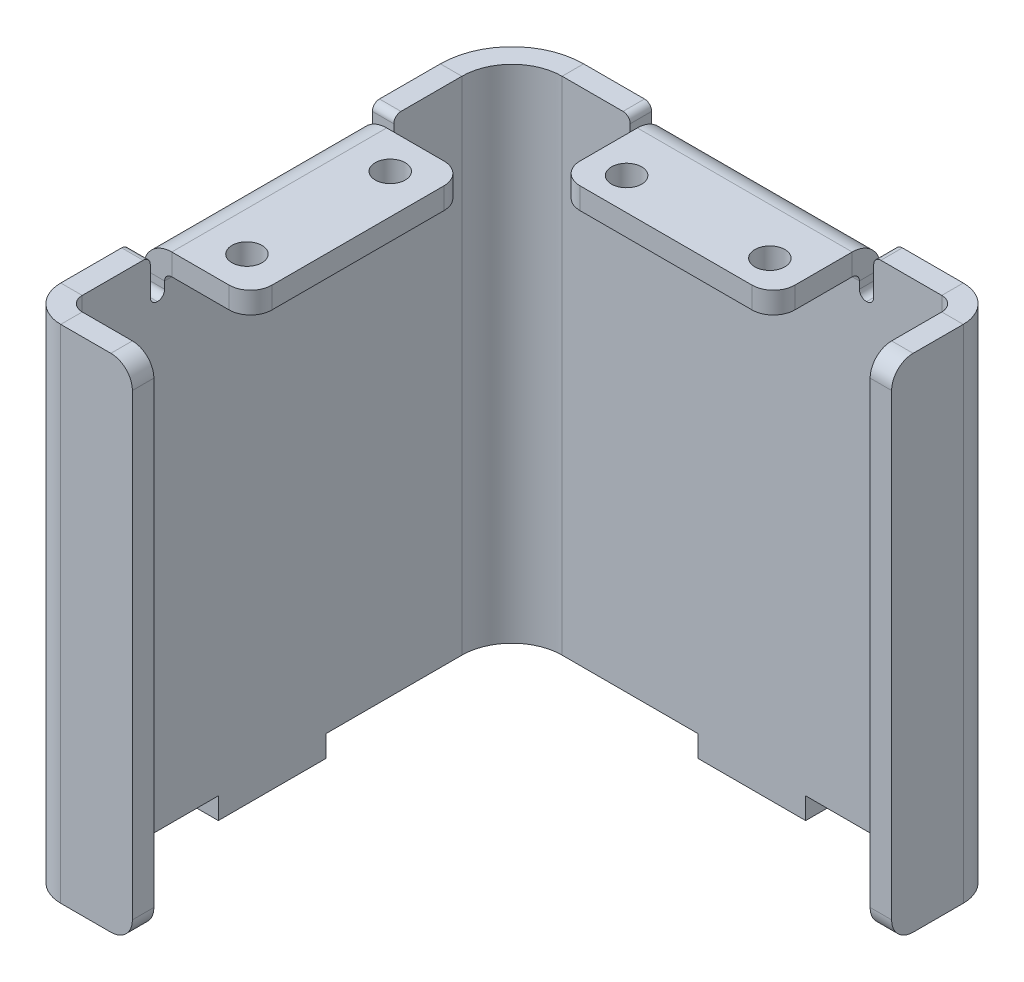
from build123d import *

# Parameters (mm, degrees)
BASE_FLANGE1_DEPTH           = 70
EDGE_FLANGE1_STRIP_W         = 16
EDGE_FLANGE1_STRIP_H         = 3
EDGE_FLANGE1_STRIP_CUT_DEPTH = 70
EDGE_FLANGE1_DEPTH           = 70
EDGE_FLANGE2_STRIP_W         = 16
EDGE_FLANGE2_STRIP_H         = 3
EDGE_FLANGE2_STRIP_CUT_DEPTH = 70
EDGE_FLANGE2_DEPTH           = 70
SKETCH19_W                   = 15
SKETCH19_H                   = 6
BOSS_EXTRUDE1_DEPTH          = 3
SKETCH20_W                   = 15
SKETCH20_H                   = 6
BOSS_EXTRUDE2_DEPTH          = 3
CUT_EXTRUDE6_DEPTH           = 3
EDGE_FLANGE8_STRIP_W         = 14
EDGE_FLANGE8_STRIP_H         = 3
EDGE_FLANGE8_STRIP_CUT_DEPTH = 30
EDGE_FLANGE8_DEPTH           = 30
SKETCH71_R                   = 2.1
CUT_EXTRUDE7_DEPTH           = 3
CUT_EXTRUDE8_DEPTH           = 3
EDGE_FLANGE9_STRIP_W         = 14
EDGE_FLANGE9_STRIP_H         = 3
EDGE_FLANGE9_STRIP_CUT_DEPTH = 30
EDGE_FLANGE9_DEPTH           = 30
SKETCH77_R                   = 2.1
CUT_EXTRUDE9_DEPTH           = 3
FILLET1_R                    = 1
FILLET2_R                    = 3


# Sheet-metal steps are written as plain solids
with BuildPart() as part:
    # Sketch1 → Base-Flange1 (new body)
    with BuildSketch(Plane(origin=(0, 0, 0), x_dir=(1, 0, 0), z_dir=(0, 1, 0))):
        with BuildLine():
            Line((0, 0), (-58, 0))
            ThreePointArc((-58, 0), (-65.071067812, -2.928932188), (-68, -10))
            Line((-68, -10), (-68, -68))
            Line((-68, -68), (-65, -68))
            Line((-65, -68), (-65, -10))
            ThreePointArc((-65, -10), (-62.949747468, -5.050252532), (-58, -3))
            Line((-58, -3), (0, -3))
            Line((0, -3), (0, 0))
        make_face()
    extrude(amount=BASE_FLANGE1_DEPTH)

    # Edge-Flange1 strip (across the edge) → Edge-Flange1 strip cut (cut)
    with BuildSketch(Plane(origin=(0, 0, 3), x_dir=(-1, 0, 0), z_dir=(0, 1, 0))):
        with Locations((-3, -1.5)):
            Rectangle(EDGE_FLANGE1_STRIP_W, EDGE_FLANGE1_STRIP_H)
    extrude(amount=EDGE_FLANGE1_STRIP_CUT_DEPTH, mode=Mode.SUBTRACT)

    # Edge-Flange1 section (across the edge) → Edge-Flange1 (add)
    with BuildSketch(Plane(origin=(0, 0, 3), x_dir=(-1, 0, 0), z_dir=(0, 1, 0))):
        with BuildLine():
            Line((0, 2), (0, 12))
            Line((0, 12), (3, 12))
            Line((3, 12), (3, 2))
            ThreePointArc((3, 2), (3.585786438, 0.585786438), (5, 0))
            Line((5, 0), (5, -3))
            ThreePointArc((5, -3), (1.464466094, -1.535533906), (0, 2))
        make_face()
    extrude(amount=EDGE_FLANGE1_DEPTH)

    # Edge-Flange2 strip (across the edge) → Edge-Flange2 strip cut (cut)
    with BuildSketch(Plane(origin=(-65, 70, 68), x_dir=(0, 0, -1), z_dir=(0, -1, 0))):
        with Locations((-3, -1.5)):
            Rectangle(EDGE_FLANGE2_STRIP_W, EDGE_FLANGE2_STRIP_H)
    extrude(amount=EDGE_FLANGE2_STRIP_CUT_DEPTH, mode=Mode.SUBTRACT)

    # Edge-Flange2 section (across the edge) → Edge-Flange2 (add)
    with BuildSketch(Plane(origin=(-65, 70, 68), x_dir=(0, 0, -1), z_dir=(0, -1, 0))):
        with BuildLine():
            Line((0, 2), (0, 12))
            Line((0, 12), (3, 12))
            Line((3, 12), (3, 2))
            ThreePointArc((3, 2), (3.585786438, 0.585786438), (5, 0))
            Line((5, 0), (5, -3))
            ThreePointArc((5, -3), (1.464466094, -1.535533906), (0, 2))
        make_face()
    extrude(amount=EDGE_FLANGE2_DEPTH)

    # Sketch19 → Boss-Extrude1 (add)
    with BuildSketch(Plane.XY.offset(3)):
        with Locations((-31.5, 0)):
            Rectangle(SKETCH19_W, SKETCH19_H)
    extrude(amount=-BOSS_EXTRUDE1_DEPTH)

    # Sketch20 → Boss-Extrude2 (add)
    with BuildSketch(Plane(origin=(-65, 0, 0), x_dir=(0, 0, -1), z_dir=(1, 0, 0))):
        with Locations((-36.5, 0)):
            Rectangle(SKETCH20_W, SKETCH20_H)
    extrude(amount=-BOSS_EXTRUDE2_DEPTH)

    # Sketch63 → Cut-Extrude6 (cut)
    with BuildSketch(Plane(origin=(-65, 0, 0), x_dir=(0, 0, -1), z_dir=(1, 0, 0))):
        Polygon((-51.5, 64), (-51.5, 67), (-51.5, 70), (-53.5, 70), (-53.5, 64), align=None)
        Polygon((-21.5, 70), (-21.5, 67), (-21.5, 64), (-19.5, 64), (-19.5, 70), align=None)
    extrude(amount=-CUT_EXTRUDE6_DEPTH, mode=Mode.SUBTRACT)

    # Edge-Flange8 strip (across the edge) → Edge-Flange8 strip cut (cut)
    with BuildSketch(Plane(origin=(-65, 70, 21.5), x_dir=(0, -1, 0), z_dir=(0, 0, 1))):
        with Locations((-3, -1.5)):
            Rectangle(EDGE_FLANGE8_STRIP_W, EDGE_FLANGE8_STRIP_H)
    extrude(amount=EDGE_FLANGE8_STRIP_CUT_DEPTH, mode=Mode.SUBTRACT)

    # Edge-Flange8 section (across the edge) → Edge-Flange8 (add)
    with BuildSketch(Plane(origin=(-65, 70, 21.5), x_dir=(0, -1, 0), z_dir=(0, 0, 1))):
        with BuildLine():
            Line((0, 1), (0, 12))
            Line((0, 12), (3, 12))
            Line((3, 12), (3, 1))
            ThreePointArc((3, 1), (3.292893219, 0.292893219), (4, 0))
            Line((4, 0), (4, -3))
            ThreePointArc((4, -3), (1.171572875, -1.828427125), (0, 1))
        make_face()
    extrude(amount=EDGE_FLANGE8_DEPTH)

    # Sketch71 → Cut-Extrude7 (cut)
    with BuildSketch(Plane(origin=(0, 70, 0), x_dir=(1, 0, 0), z_dir=(0, 1, 0))):
        with Locations(Location((-58.5, -26.5, 0), (0, 0, 180))):
            Circle(SKETCH71_R)
        with Locations(Location((-58.5, -46.5, 0), (0, 0, 180))):
            Circle(SKETCH71_R)
    extrude(amount=-CUT_EXTRUDE7_DEPTH, mode=Mode.SUBTRACT)

    # Sketch72 → Cut-Extrude8 (cut)
    with BuildSketch(Plane.XY.offset(3)):
        Polygon((-46.5, 66.882619945), (-46.5, 70), (-48.5, 70), (-48.5, 64), (-46.5, 64), align=None)
        Polygon((-14.5, 70), (-16.5, 70), (-16.5, 66.882619945), (-16.5, 64), (-14.5, 64), align=None)
    extrude(amount=-CUT_EXTRUDE8_DEPTH, mode=Mode.SUBTRACT)

    # Edge-Flange9 strip (across the edge) → Edge-Flange9 strip cut (cut)
    with BuildSketch(Plane(origin=(-16.5, 70, 3), x_dir=(0, -1, 0), z_dir=(-1, 0, 0))):
        with Locations((-3, -1.5)):
            Rectangle(EDGE_FLANGE9_STRIP_W, EDGE_FLANGE9_STRIP_H)
    extrude(amount=EDGE_FLANGE9_STRIP_CUT_DEPTH, mode=Mode.SUBTRACT)

    # Edge-Flange9 section (across the edge) → Edge-Flange9 (add)
    with BuildSketch(Plane(origin=(-16.5, 70, 3), x_dir=(0, -1, 0), z_dir=(-1, 0, 0))):
        with BuildLine():
            Line((0, 1), (0, 12))
            Line((0, 12), (3, 12))
            Line((3, 12), (3, 1))
            ThreePointArc((3, 1), (3.292893219, 0.292893219), (4, 0))
            Line((4, 0), (4, -3))
            ThreePointArc((4, -3), (1.171572875, -1.828427125), (0, 1))
        make_face()
    extrude(amount=EDGE_FLANGE9_DEPTH)

    # Sketch77 → Cut-Extrude9 (cut)
    with BuildSketch(Plane(origin=(0, 70, 0), x_dir=(1, 0, 0), z_dir=(0, 1, 0))):
        with Locations(Location((-41.5, -10.5, 0), (0, 0, 270))):
            Circle(SKETCH77_R)
        with Locations(Location((-21.5, -10.5, 0), (0, 0, 270))):
            Circle(SKETCH77_R)
    extrude(amount=-CUT_EXTRUDE9_DEPTH, mode=Mode.SUBTRACT)

    # Fillet1
    fillet1_edges = [part.edges().sort_by_distance(p)[0] for p in [
        (-66.5, 70, 53.5),
        (-66.5, 64, 53.5),
        (-66.5, 64, 51.5),
        (-66.5, 64, 21.5),
        (-66.5, 64, 19.5),
        (-66.5, 70, 19.5),
        (-14.5, 70, 1.5),
        (-48.5, 70, 1.5),
        (-14.5, 64, 1.5),
        (-16.5, 64, 1.5),
        (-46.5, 64, 1.5),
        (-48.5, 64, 1.5),
    ]]
    fillet(fillet1_edges, radius=FILLET1_R - 0.0001)  # a hair under: the kernel refuses the full size

    # Fillet2
    fillet2_edges = [part.edges().sort_by_distance(p)[0] for p in [
        (-1.5, 70, 15),
        (-1.5, 0, 15),
        (-53, 0, 66.5),
        (-53, 70, 66.5),
        (-53, 68.5, 21.5),
        (-53, 68.5, 51.5),
        (-16.5, 68.5, 15),
        (-46.5, 68.5, 15),
    ]]
    fillet(fillet2_edges, radius=FILLET2_R)


solid = part.part
